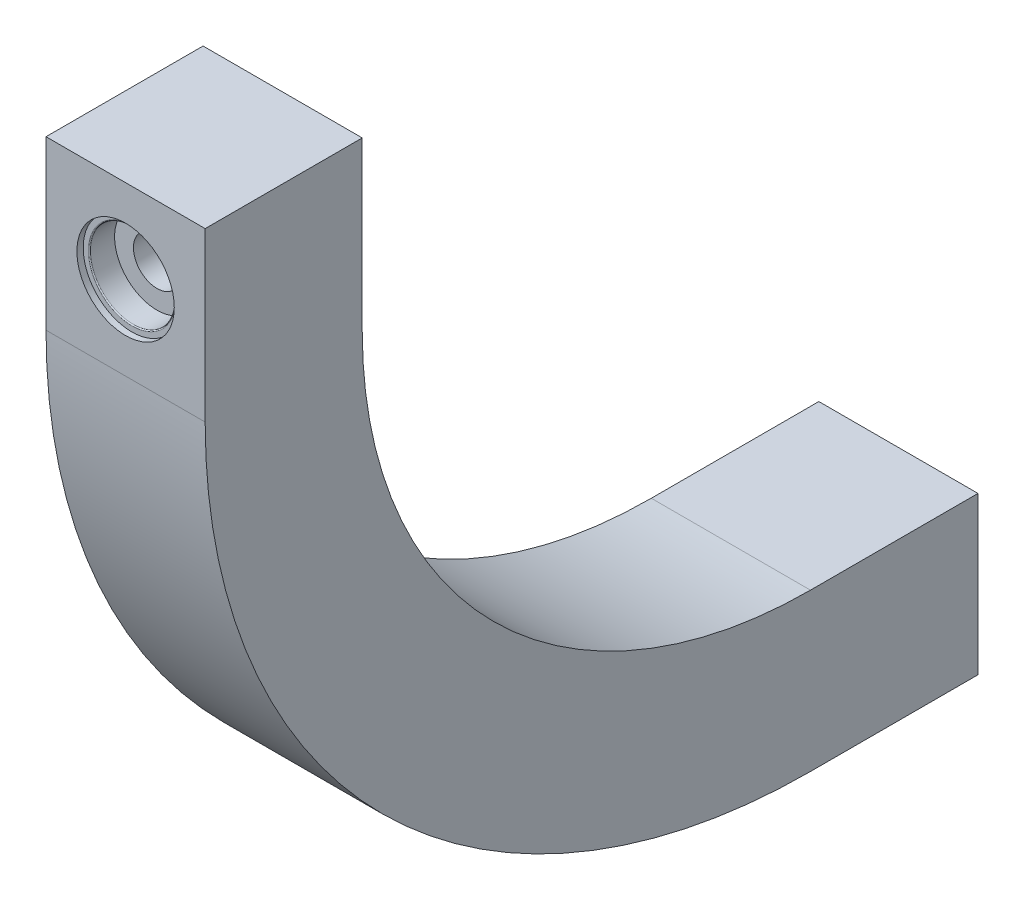
from build123d import *

# Parameters (mm, degrees)
BOSS_EXTRUDE1_DEPTH      = 7.6
BOSS_EXTRUDE1_DEPTH_BACK = 7.6
SKETCH7_R                = 2.25
CUT_EXTRUDE1_DEPTH       = 94.371547498
SKETCH15_R               = 2.05
CUT_EXTRUDE11_DEPTH      = 10


with BuildPart() as part:
    # Sketch5 → Boss-Extrude1 (new, two sides: drawn at the far end of the back side and taken through both)
    with BuildSketch(Plane(origin=(0, 0, 0), x_dir=(0, 0, -1), z_dir=(1, 0, 0)).offset(-BOSS_EXTRUDE1_DEPTH_BACK)):
        with BuildLine():
            Line((-50.80458146, 8), (-50.80458146, 0))
            Line((-50.80458146, 0), (-50.80458146, -8))
            ThreePointArc((-50.80458146, -8), (-38.267409816, -38.267409816), (-8, -50.80458146))
            Line((-8, -50.80458146), (0, -50.80458146))
            Line((0, -50.80458146), (8, -50.80458146))
            Line((8, -50.80458146), (8, -65.80458146))
            Line((8, -65.80458146), (-8, -65.80458146))
            ThreePointArc((-8, -65.80458146), (-48.874011534, -48.874011534), (-65.80458146, -8))
            Line((-65.80458146, -8), (-65.80458146, 8))
            Line((-65.80458146, 8), (-50.80458146, 8))
        make_face()
    extrude(amount=BOSS_EXTRUDE1_DEPTH + BOSS_EXTRUDE1_DEPTH_BACK)

    # Sketch7 → Cut-Extrude1 (cut, through all)
    with BuildSketch(Plane.XY):
        Circle(SKETCH7_R)
    extrude(amount=CUT_EXTRUDE1_DEPTH, mode=Mode.SUBTRACT)

    # Sketch15 → Cut-Extrude11 (cut)
    with BuildSketch(Plane.XZ.offset(65.80458146)):
        Circle(SKETCH15_R)
    extrude(amount=-CUT_EXTRUDE11_DEPTH, mode=Mode.SUBTRACT)

    # Sketch18 → Cut-Revolve1 (revolve, cut)
    with BuildSketch(Plane(origin=(0, 0, 0), x_dir=(0, 0, -1), z_dir=(1, 0, 0))):
        with BuildLine():
            Line((-65.80458146, 4.65), (-65.80458146, 0))
            Line((-65.80458146, 0), (-62.80458146, 0))
            Line((-62.80458146, 0), (-62.80458146, 4.05))
            Line((-62.80458146, 4.05), (-65.10458146, 4.05))
            ThreePointArc((-65.10458146, 4.05), (-65.175292138, 4.079289322), (-65.20458146, 4.15))
            Line((-65.20458146, 4.15), (-65.20458146, 4.65))
            Line((-65.20458146, 4.65), (-65.80458146, 4.65))
        make_face()
        with BuildLine():
            Line((-51.40458146, 4.65), (-50.80458146, 4.65))
            Line((-50.80458146, 4.65), (-50.80458146, 0))
            Line((-50.80458146, 0), (-53.80458146, 0))
            Line((-53.80458146, 0), (-53.80458146, 4.05))
            Line((-53.80458146, 4.05), (-51.50458146, 4.05))
            ThreePointArc((-51.50458146, 4.05), (-51.433870782, 4.079289322), (-51.40458146, 4.15))
            Line((-51.40458146, 4.15), (-51.40458146, 4.65))
        make_face()
    revolve(axis=Axis((0, 0, 109.558527697), (0, 0, -1)), mode=Mode.SUBTRACT)


solid = part.part
